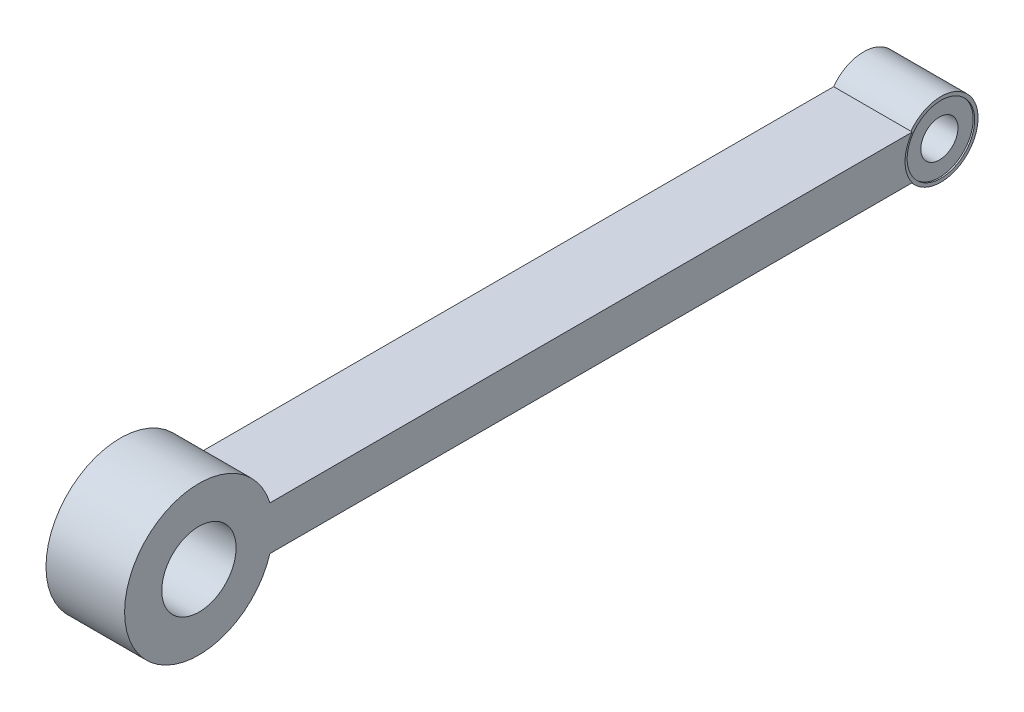
from build123d import *
from build123d.topology import SkipClean

# Parameters (mm, degrees)
SKETCH1_R               = 2.5
BOSS_EXTRUDE1_DEPTH     = 5
SKETCH2_R               = 1.25
CUT_EXTRUDE1_DEPTH      = 10
BOSS_EXTRUDE2_START     = 0.1
SKETCH4_R               = 2.5
SKETCH4_R_2             = 2.107798696
BOSS_EXTRUDE2_DEPTH     = 0.1
SKETCH5_R               = 2.5
SKETCH5_R_2             = 2.269592882
BOSS_EXTRUDE3_DEPTH     = 0.1
BOSS_EXTRUDE5_START     = -0.098685172
BOSS_EXTRUDE5_DEPTH     = 5.286540914
SKETCH12_W              = 5.286540914
SKETCH12_H              = 2.95536745
BOSS_EXTRUDE6_DEPTH     = 30
BOSS_EXTRUDE7_START     = -5.286541
SKETCH13_R              = 5
BOSS_EXTRUDE7_DEPTH     = 5.286541
CUT_EXTRUDE2_DEPTH      = 56.479378316
CUT_EXTRUDE2_DEPTH_BACK = 56.479378316
SKETCH14_R              = 2.5


# Read off the part's stored shape, not the designer's step: Boss-Extrude5
with BuildPart() as part:
    # Sketch1 → Boss-Extrude1 (new body)
    with BuildSketch(Plane(origin=(0, 0, 0), x_dir=(0, 0, -1), z_dir=(1, 0, 0))):
        Circle(SKETCH1_R)
    extrude(amount=BOSS_EXTRUDE1_DEPTH)

    # Sketch2 → Cut-Extrude1 (cut)
    with BuildSketch(Plane.ZY):
        Circle(SKETCH2_R)
    extrude(amount=-CUT_EXTRUDE1_DEPTH, mode=Mode.SUBTRACT)

    # Sketch4 → Boss-Extrude2 (add)
    with BuildSketch(Plane.ZY.offset(BOSS_EXTRUDE2_START)):
        Circle(SKETCH4_R)
        Circle(SKETCH4_R_2, mode=Mode.SUBTRACT)
    extrude(amount=-BOSS_EXTRUDE2_DEPTH)

    # Sketch5 → Boss-Extrude3 (add)
    with BuildSketch(Plane(origin=(5, 0, 0), x_dir=(0, 0, -1), z_dir=(1, 0, 0))):
        with Locations(Location((0, 0, 0), (0, 0, 180))):
            Circle(SKETCH5_R)
        Circle(SKETCH5_R_2, mode=Mode.SUBTRACT)
    extrude(amount=BOSS_EXTRUDE3_DEPTH)

    # Boss-Extrude5 outline → Boss-Extrude5 (add)
    with SkipClean():  # the faces are left unmerged after this step: merging them gives an invalid solid
        with BuildSketch(Plane.YZ.offset(BOSS_EXTRUDE5_START)):
            with BuildLine():
                Line((-1.477683725, 20), (-1.477683725, 2.016544274))
                ThreePointArc((-1.477683725, 2.016544274), (0, 2.5), (1.477683725, 2.016544274))
                Line((1.477683725, 2.016544274), (1.477683725, 20))
                Line((1.477683725, 20), (-1.477683725, 20))
            make_face()
        extrude(amount=BOSS_EXTRUDE5_DEPTH)

    # Sketch12 → Boss-Extrude6 (add)
    with SkipClean():  # the faces are left unmerged after this step: merging them gives an invalid solid
        with BuildSketch(Plane.XY.offset(20)):
            with Locations((2.544585285, 0)):
                Rectangle(SKETCH12_W, SKETCH12_H)
        extrude(amount=BOSS_EXTRUDE6_DEPTH)

    # Sketch13 → Boss-Extrude7 (add)
    with SkipClean():  # the faces are left unmerged after this step: merging them gives an invalid solid
        with BuildSketch(Plane(origin=(5.187855742, 0, 0), x_dir=(0, 0, -1), z_dir=(1, 0, 0)).offset(BOSS_EXTRUDE7_START)):
            with Locations((-50, 0)):
                Circle(SKETCH13_R)
        extrude(amount=BOSS_EXTRUDE7_DEPTH)

    # Sketch14 → Cut-Extrude2 (cut, two sides: drawn at the far end of the back side and taken through both)
    with SkipClean():  # the faces are left unmerged after this step: merging them gives an invalid solid
        with BuildSketch(Plane(origin=(5.187855742, 0, 0), x_dir=(0, 0, -1), z_dir=(1, 0, 0)).offset(-CUT_EXTRUDE2_DEPTH_BACK)):
            with Locations((-50, 0)):
                Circle(SKETCH14_R)
        extrude(amount=CUT_EXTRUDE2_DEPTH + CUT_EXTRUDE2_DEPTH_BACK, mode=Mode.SUBTRACT)


solid = part.part
